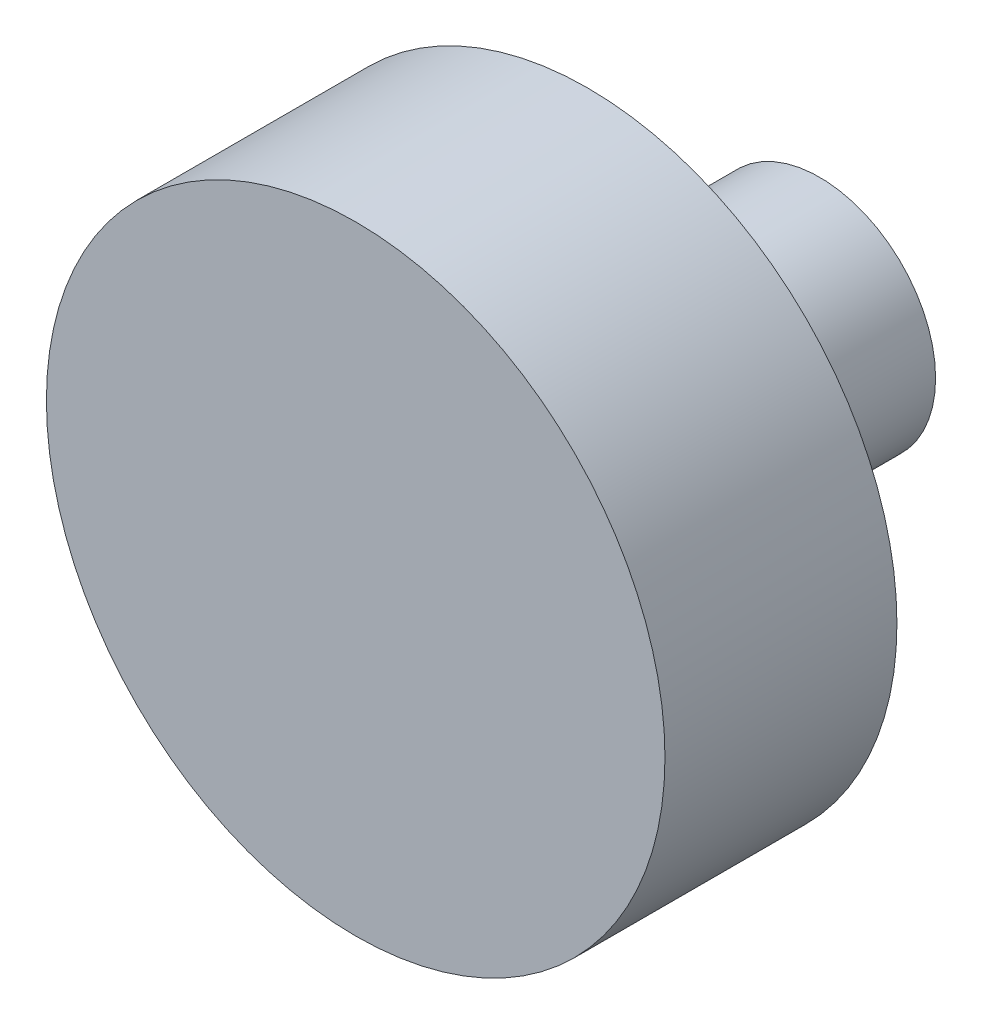
from build123d import *

# Parameters (mm, degrees)
SKETCH1_R           = 101.6
BOSS_EXTRUDE1_DEPTH = 76.2
SKETCH2_R           = 38.1
BOSS_EXTRUDE2_DEPTH = 76.2
SKETCH2_3_R         = 38.1
BOSS_EXTRUDE3_DEPTH = 76.2


with BuildPart() as part:
    # Sketch1 → Boss-Extrude1 (new body)
    with BuildSketch(Plane.XY):
        Circle(SKETCH1_R)
    extrude(amount=BOSS_EXTRUDE1_DEPTH)

    # Sketch2 → Boss-Extrude2 (add)
    with BuildSketch(Plane.XY):
        Circle(SKETCH2_R)
    extrude(amount=BOSS_EXTRUDE2_DEPTH)

    # Sketch2<3> → Boss-Extrude3 (add)
    with BuildSketch(Plane.XY):
        Circle(SKETCH2_3_R)
    extrude(amount=-BOSS_EXTRUDE3_DEPTH)


solid = part.part
